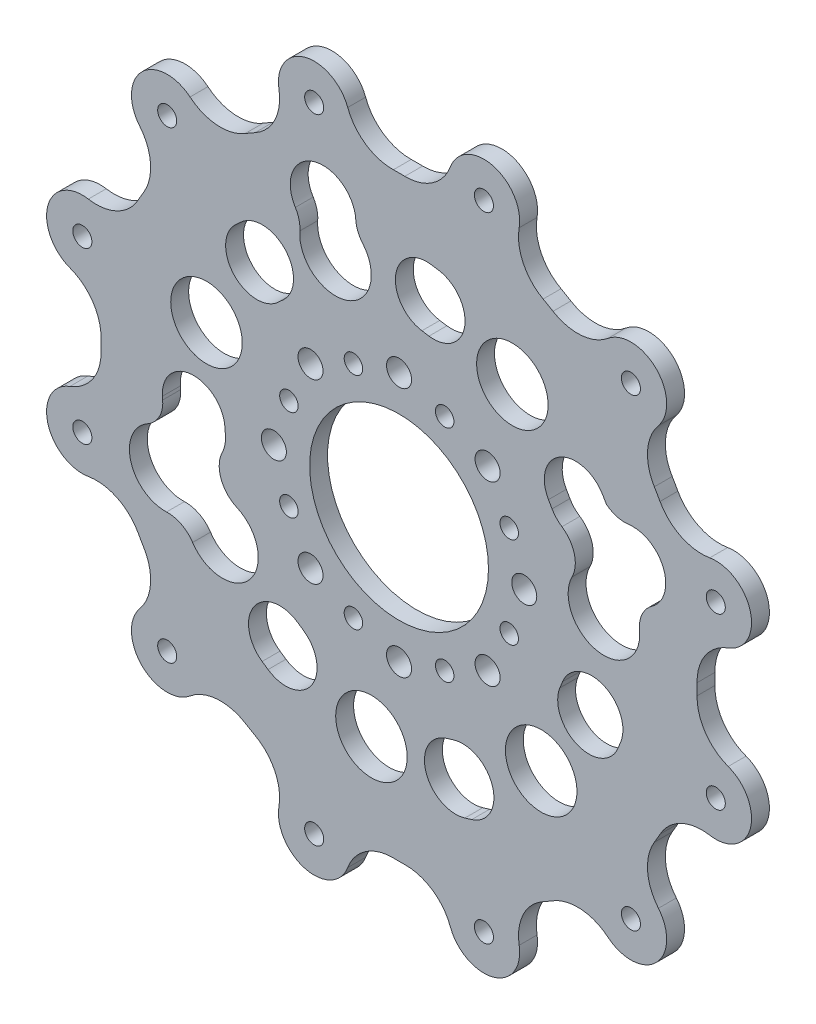
from build123d import *

# Parameters (mm, degrees)
SKETCH1_R           = 15
BOSS_EXTRUDE1_DEPTH = 3
SKETCH2_R           = 2.5
CUT_EXTRUDE1_DEPTH  = 92.972822073
SKETCH3_R           = 1.6
CUT_EXTRUDE2_DEPTH  = 92.972822073
SKETCH4_R           = 2.1
SKETCH4_R_2         = 1.55
CUT_EXTRUDE3_DEPTH  = 92.972822073
SKETCH7_R           = 6
CUT_EXTRUDE8_DEPTH  = 92.972822073
FILLET1_R           = 5
CUT_EXTRUDE9_DEPTH  = 92.972822073
SKETCH9_R           = 65
CUT_EXTRUDE10_DEPTH = 92.972822073


with BuildPart() as part:
    # Sketch1 → Boss-Extrude1 (new body)
    with BuildSketch(Plane.XY):
        with BuildLine():
            ThreePointArc((65, 0), (0, 65), (-65, 0))
            ThreePointArc((-65, 0), (-45.961940777, -45.961940777), (0, -65))
            ThreePointArc((0, -65), (45.961940777, -45.961940777), (65, 0))
        make_face()
        Circle(SKETCH1_R, mode=Mode.SUBTRACT)
    extrude(amount=BOSS_EXTRUDE1_DEPTH)

    # Sketch2 → Cut-Extrude1 (cut, through all)
    with BuildSketch(Plane.XY.offset(3)):
        with Locations((0, 61)):
            Circle(SKETCH2_R)
        with Locations((52.827549631, 30.5)):
            Circle(SKETCH2_R)
        with Locations((52.827549631, -30.5)):
            Circle(SKETCH2_R)
        with Locations((0, -61)):
            Circle(SKETCH2_R)
        with Locations((-52.827549631, -30.5)):
            Circle(SKETCH2_R)
        with Locations((-52.827549631, 30.5)):
            Circle(SKETCH2_R)
    extrude(amount=-CUT_EXTRUDE1_DEPTH, mode=Mode.SUBTRACT)

    # Sketch3 → Cut-Extrude2 (cut, through all)
    with BuildSketch(Plane.XY.offset(3)):
        with Locations((14.235047481, 53.125920446)):
            Circle(SKETCH3_R)
        with Locations((38.890872965, 38.890872965)):
            Circle(SKETCH3_R)
        with Locations((53.125920446, 14.235047481)):
            Circle(SKETCH3_R)
        with Locations((53.125920446, -14.235047481)):
            Circle(SKETCH3_R)
        with Locations((38.890872965, -38.890872965)):
            Circle(SKETCH3_R)
        with Locations((14.235047481, -53.125920446)):
            Circle(SKETCH3_R)
        with Locations((-14.235047481, -53.125920446)):
            Circle(SKETCH3_R)
        with Locations((-38.890872965, -38.890872965)):
            Circle(SKETCH3_R)
        with Locations((-53.125920446, -14.235047481)):
            Circle(SKETCH3_R)
        with Locations((-53.125920446, 14.235047481)):
            Circle(SKETCH3_R)
        with Locations((-38.890872965, 38.890872965)):
            Circle(SKETCH3_R)
        with Locations((-14.235047481, 53.125920446)):
            Circle(SKETCH3_R)
    extrude(amount=-CUT_EXTRUDE2_DEPTH, mode=Mode.SUBTRACT)

    # Sketch4 → Cut-Extrude3 (cut, through all)
    with BuildSketch(Plane.XY.offset(3)):
        with Locations((0, 21)):
            Circle(SKETCH4_R)
        with Locations((7.653668647, 18.47759065)):
            Circle(SKETCH4_R_2)
        with Locations((14.849242405, 14.849242405)):
            Circle(SKETCH4_R)
        with Locations((18.47759065, 7.653668647)):
            Circle(SKETCH4_R_2)
        with Locations((21, 0)):
            Circle(SKETCH4_R)
        with Locations((18.47759065, -7.653668647)):
            Circle(SKETCH4_R_2)
        with Locations((14.849242405, -14.849242405)):
            Circle(SKETCH4_R)
        with Locations((7.653668647, -18.47759065)):
            Circle(SKETCH4_R_2)
        with Locations((0, -21)):
            Circle(SKETCH4_R)
        with Locations((-7.653668647, -18.47759065)):
            Circle(SKETCH4_R_2)
        with Locations((-14.849242405, -14.849242405)):
            Circle(SKETCH4_R)
        with Locations((-18.47759065, -7.653668647)):
            Circle(SKETCH4_R_2)
        with Locations((-21, 0)):
            Circle(SKETCH4_R)
        with Locations((-18.47759065, 7.653668647)):
            Circle(SKETCH4_R_2)
        with Locations((-14.849242405, 14.849242405)):
            Circle(SKETCH4_R)
        with Locations((-7.653668647, 18.47759065)):
            Circle(SKETCH4_R_2)
    extrude(amount=-CUT_EXTRUDE3_DEPTH, mode=Mode.SUBTRACT)

    # Sketch7 → Cut-Extrude8 (cut, through all)
    with BuildSketch(Plane(origin=(0, 0, 0), x_dir=(-1, 0, 0), z_dir=(0, 0, -1))):
        with Locations((-19.00594586, 28.792777253)):
            Circle(SKETCH7_R)
        with Locations((-23.84166139, -24.936422802)):
            Circle(SKETCH7_R)
        with Locations((4.631047671, -34.187766781)):
            Circle(SKETCH7_R)
        with Locations((32.300103037, 12.122431431)):
            Circle(SKETCH7_R)
        with BuildLine():
            Line((29.211828059, -1.512208283), (29.124831267, -2.713277739))
            ThreePointArc((29.124831267, -2.713277739), (30.830152733, -6.977761246), (35.237764272, -8.268846605))
            ThreePointArc((35.237764272, -8.268846605), (33.723320383, -10.366915364), (33.233233248, -12.907633256))
            ThreePointArc((33.233233248, -12.907633256), (24.281529428, -20.440615416), (35.614331428, -17.534342832))
            ThreePointArc((35.614331428, -17.534342832), (45.085903335, -14.058842365), (38.003002053, -6.873977208))
            ThreePointArc((38.003002053, -6.873977208), (39.114966606, -5.320419988), (39.597395019, -3.471834575))
            Line((39.597395019, -3.471834575), (39.68439181, -2.270765119))
            ThreePointArc((39.68439181, -2.270765119), (34.827388353, 3.344795175), (29.211828059, -1.512208283))
        make_face()
        with BuildLine():
            Line((19.395568932, 21.895880394), (20.280361233, 21.079009006))
            ThreePointArc((20.280361233, 21.079009006), (27.699075186, 21.375122645), (27.402961547, 28.793836598))
            Line((27.402961547, 28.793836598), (26.518169246, 29.610707986))
            ThreePointArc((26.518169246, 29.610707986), (19.099455293, 29.314594347), (19.395568932, 21.895880394))
        make_face()
        with BuildLine():
            Line((-5.025949199, 28.81592454), (-3.835634454, 28.998372037))
            ThreePointArc((-3.835634454, 28.998372037), (0.558347074, 34.983179998), (-5.426460888, 39.377161525))
            Line((-5.426460888, 39.377161525), (-6.616775633, 39.194714029))
            ThreePointArc((-6.616775633, 39.194714029), (-11.01075716, 33.209906067), (-5.025949199, 28.81592454))
        make_face()
        with BuildLine():
            Line((-25.662825072, 14.036989769), (-25.063319164, 15.081369464))
            ThreePointArc((-25.063319164, 15.081369464), (-27.002827773, 22.248189286), (-34.169647595, 20.308680677))
            Line((-34.169647595, 20.308680677), (-34.769153502, 19.264300982))
            ThreePointArc((-34.769153502, 19.264300982), (-35.275067351, 18.053581277), (-35.464947632, 16.755222118))
            ThreePointArc((-35.464947632, 16.755222118), (-44.442683907, 14.504562533), (-38.661641025, 7.276508826))
            ThreePointArc((-38.661641025, 7.276508826), (-31.658862246, -2.264480346), (-35.170045167, 9.037775159))
            ThreePointArc((-35.170045167, 9.037775159), (-34.102679785, 10.75961664), (-33.731082846, 12.751079083))
            ThreePointArc((-33.731082846, 12.751079083), (-29.389678664, 11.466080711), (-25.662825072, 14.036989769))
        make_face()
        with BuildLine():
            Line((-26.975070239, -11.3120846), (-27.417813345, -10.192211919))
            ThreePointArc((-27.417813345, -10.192211919), (-34.230322549, -7.240141739), (-37.182392729, -14.052650943))
            Line((-37.182392729, -14.052650943), (-36.739649623, -15.172523625))
            ThreePointArc((-36.739649623, -15.172523625), (-29.927140419, -18.124593804), (-26.975070239, -11.3120846))
        make_face()
        with BuildLine():
            Line((-7.974537326, -28.142928541), (-9.126134856, -27.790849843))
            ThreePointArc((-9.126134856, -27.790849843), (-15.681686275, -31.276498362), (-12.196037756, -37.832049781))
            Line((-12.196037756, -37.832049781), (-11.044440225, -38.184128479))
            ThreePointArc((-11.044440225, -38.184128479), (-4.488888807, -34.69847996), (-7.974537326, -28.142928541))
        make_face()
        with BuildLine():
            Line((17.030984845, -23.781573279), (16.037709319, -24.462411006))
            ThreePointArc((16.037709319, -24.462411006), (14.675579613, -31.761013795), (21.974182401, -33.123143501))
            Line((21.974182401, -33.123143501), (22.967457927, -32.442305774))
            ThreePointArc((22.967457927, -32.442305774), (24.329587633, -25.143702985), (17.030984845, -23.781573279))
        make_face()
        with BuildLine():
            ThreePointArc((7.42034117, 37.860961765), (8.80698434, 27.105110714), (16.250932852, 34.991728599))
            ThreePointArc((16.250932852, 34.991728599), (14.446544487, 44.461892137), (7.42034117, 37.860961765))
        make_face()
    extrude(amount=-CUT_EXTRUDE8_DEPTH, mode=Mode.SUBTRACT)

    # Fillet1
    # the kernel refuses this fillet: 5 mm, written as the material it takes off along each edge
    with BuildSketch(Plane(origin=(38.661641025, 7.276508826, -9.896060759), x_dir=(0.42185900766131856, -0.9066614459956968, 0), z_dir=(0, 0, 1))) as fillet1_piece_1:
        with BuildLine():
            CenterArc((5.607767764, 4.720134124), FILLET1_R, 190.403540924, 60.335653251)
            ThreePointArc((0.6899662, 3.817234472), (0.692683339, 1.845770321), (0, 0))
            ThreePointArc((0, 0), (1.979212152, 0.335839051), (3.958424304, 0))
        make_face()
    extrude(amount=22.792121518, mode=Mode.SUBTRACT)
    with BuildSketch(Plane(origin=(35.464947632, 16.755222118, -8.483370588), x_dir=(-0.2672258860055957, 0.9636339169251591, 0), z_dir=(0, 0, 1))) as fillet1_piece_2:
        with BuildLine():
            CenterArc((5.523232667, -4.059153148), FILLET1_R, 125.724823578, 46.055940706)
            ThreePointArc((0.574591213, -3.344347049), (0.551663608, -1.626752541), (0, 0))
            ThreePointArc((0, 0), (1.301883848, -0.163980098), (2.603767696, 0))
        make_face()
    extrude(amount=19.966741176, mode=Mode.SUBTRACT)
    with BuildSketch(Plane(origin=(-16.250932852, 34.991728599, -4.440296256), x_dir=(-0.660275414523551, 0.7510235528768409, 0), z_dir=(0, 0, 1))) as fillet1_piece_3:
        with BuildLine():
            CenterArc((2.531667396, 4.937012043), FILLET1_R, 224.394439463, 36.501432246)
            ThreePointArc((-1.041035496, 1.439042053), (-0.466974775, 0.758255222), (0, 0))
            ThreePointArc((0, 0), (0.870260667, 0.069286753), (1.740521335, 0))
        make_face()
    extrude(amount=11.880592512, mode=Mode.SUBTRACT)
    with BuildSketch(Plane(origin=(-7.42034117, 37.860961765, -4.440296256), x_dir=(0.09273346281218257, 0.9956909685614617, 0), z_dir=(0, 0, 1))) as fillet1_piece_4:
        with BuildLine():
            CenterArc((2.531667396, -4.937012043), FILLET1_R, 99.104128291, 36.501432246)
            ThreePointArc((-1.041035496, -1.439042053), (-0.466974775, -0.758255222), (0, 0))
            ThreePointArc((0, 0), (0.870260667, -0.069286753), (1.740521335, 0))
        make_face()
    extrude(amount=11.880592512, mode=Mode.SUBTRACT)
    with BuildSketch(Plane(origin=(-35.614331428, -17.534342832, -8.986889126), x_dir=(-0.941830418205035, -0.33608847546997045, 0), z_dir=(0, 0, 1))) as fillet1_piece_5:
        with BuildLine():
            CenterArc((5.092570505, 4.770382654), FILLET1_R, 193.689385096, 58.879258864)
            ThreePointArc((0.234605599, 3.587091914), (0.392256184, 1.775563255), (0, 0))
            ThreePointArc((0, 0), (1.797377825, 0.275540816), (3.59475565, 0))
        make_face()
    extrude(amount=20.973778252, mode=Mode.SUBTRACT)
    with BuildSketch(Plane(origin=(-38.003002053, -6.873977208, -10.974059848), x_dir=(-0.3742490954926046, 0.9273282129445687, 0), z_dir=(0, 0, 1))) as fillet1_piece_6:
        with BuildLine():
            CenterArc((5.92101268, 4.759710971), FILLET1_R, 187.432417981, 64.732529201)
            Line((0.963022025, 4.112927651), (0.467222959, 4.048249319))
            ThreePointArc((0.467222959, 4.048249319), (0.368596297, 2.082902257), (-0.41554723, 0.278065639))
            Line((-0.41554723, 0.278065639), (0.204156647, -0.456420928))
            ThreePointArc((0.204156647, -0.456420928), (3.598464099, -0.270694321), (4.236485065, -0.475971097))
            Line((4.236485065, -0.475971097), (4.389623939, 0))
        make_face()
    extrude(amount=24.948119696, mode=Mode.SUBTRACT)

    # Sketch8 → Cut-Extrude9 (cut, through all)
    with BuildSketch(Plane.XY.offset(3)):
        with BuildLine():
            ThreePointArc((-29.65430959, -5.418174422), (-29.87199695, -9.337936117), (-27.192023103, -12.206674465))
            ThreePointArc((-27.192023103, -12.206674465), (-30.308021104, -11.735010341), (-33.233233248, -12.907633256))
            ThreePointArc((-33.233233248, -12.907633256), (-33.723320383, -10.366915364), (-35.237764272, -8.268846605))
            ThreePointArc((-35.237764272, -8.268846605), (-31.973834384, -7.768387648), (-29.65430959, -5.418174422))
        make_face()
        with BuildLine():
            ThreePointArc((35.170045167, 9.037775159), (31.582172041, 8.410214133), (29.018390153, 5.822997706))
            ThreePointArc((29.018390153, 5.822997706), (29.401567289, 9.370552414), (27.322154308, 12.270209425))
            ThreePointArc((27.322154308, 12.270209425), (30.60879899, 11.415361187), (33.731082846, 12.751079083))
            ThreePointArc((33.731082846, 12.751079083), (34.102679785, 10.75961664), (35.170045167, 9.037775159))
        make_face()
    extrude(amount=-CUT_EXTRUDE9_DEPTH, mode=Mode.SUBTRACT)

    # Sketch9 → Cut-Extrude10 (cut, through all)
    with BuildSketch(Plane.XY.offset(3)):
        Circle(SKETCH9_R)
        with BuildLine():
            ThreePointArc((-20.149761589, 52.117874306), (-15.787961751, 58.921475404), (-8.608731737, 55.210283935))
            ThreePointArc((-8.608731737, 55.210283935), (-5.613939934, 51.379799195), (-0.954290873, 49.99089246))
            ThreePointArc((-0.954290873, 49.99089246), (0, 50), (0.954290873, 49.99089246))
            ThreePointArc((0.954290873, 49.99089246), (5.613939934, 51.379799195), (8.608731737, 55.210283935))
            ThreePointArc((8.608731737, 55.210283935), (15.293845275, 59.031760541), (20.235047481, 53.125920446))
            ThreePointArc((20.235047481, 53.125920446), (20.213687989, 52.620096686), (20.149761589, 52.117874306))
            ThreePointArc((20.149761589, 52.117874306), (20.828084999, 47.303181311), (24.169006092, 43.770528264))
            ThreePointArc((24.169006092, 43.770528264), (25, 43.301270189), (25.821886368, 42.816237392))
            ThreePointArc((25.821886368, 42.816237392), (30.551714195, 41.689241377), (35.060522346, 43.509142569))
            ThreePointArc((35.060522346, 43.509142569), (41.442136994, 44.321439405), (44.890872965, 38.890872965))
            ThreePointArc((44.890872965, 38.890872965), (44.534879416, 36.854898705), (43.509142569, 35.060522346))
            ThreePointArc((43.509142569, 35.060522346), (41.689241377, 30.551714195), (42.816237392, 25.821886368))
            ThreePointArc((42.816237392, 25.821886368), (43.301270189, 25), (43.770528264, 24.169006092))
            ThreePointArc((43.770528264, 24.169006092), (47.303181311, 20.828084999), (52.117874306, 20.149761589))
            ThreePointArc((52.117874306, 20.149761589), (56.995786281, 18.820256137), (59.125920446, 14.235047481))
            ThreePointArc((59.125920446, 14.235047481), (58.050663126, 10.807671001), (55.210283935, 8.608731737))
            ThreePointArc((55.210283935, 8.608731737), (51.379799195, 5.613939934), (49.99089246, 0.954290873))
            ThreePointArc((49.99089246, 0.954290873), (49.997723063, 0.477167166), (50, 0))
            ThreePointArc((50, 0), (49.997723063, -0.477167166), (49.99089246, -0.954290873))
            ThreePointArc((49.99089246, -0.954290873), (51.379799195, -5.613939934), (55.210283935, -8.608731737))
            ThreePointArc((55.210283935, -8.608731737), (58.050663126, -10.807671001), (59.125920446, -14.235047481))
            ThreePointArc((59.125920446, -14.235047481), (56.995786281, -18.820256137), (52.117874306, -20.149761589))
            ThreePointArc((52.117874306, -20.149761589), (47.303181311, -20.828084999), (43.770528264, -24.169006092))
            ThreePointArc((43.770528264, -24.169006092), (43.301270189, -25), (42.816237392, -25.821886368))
            ThreePointArc((42.816237392, -25.821886368), (41.689241377, -30.551714195), (43.509142569, -35.060522346))
            ThreePointArc((43.509142569, -35.060522346), (44.534879416, -36.854898705), (44.890872965, -38.890872965))
            ThreePointArc((44.890872965, -38.890872965), (41.442136994, -44.321439405), (35.060522346, -43.509142569))
            ThreePointArc((35.060522346, -43.509142569), (30.551714195, -41.689241377), (25.821886368, -42.816237392))
            ThreePointArc((25.821886368, -42.816237392), (25, -43.301270189), (24.169006092, -43.770528264))
            ThreePointArc((24.169006092, -43.770528264), (20.828084999, -47.303181311), (20.149761589, -52.117874306))
            ThreePointArc((20.149761589, -52.117874306), (20.213687989, -52.620096686), (20.235047481, -53.125920446))
            ThreePointArc((20.235047481, -53.125920446), (15.293845275, -59.031760541), (8.608731737, -55.210283935))
            ThreePointArc((8.608731737, -55.210283935), (5.613939934, -51.379799195), (0.954290873, -49.99089246))
            ThreePointArc((0.954290873, -49.99089246), (0, -50), (-0.954290873, -49.99089246))
            ThreePointArc((-0.954290873, -49.99089246), (-5.613939934, -51.379799195), (-8.608731737, -55.210283935))
            ThreePointArc((-8.608731737, -55.210283935), (-15.787961751, -58.921475404), (-20.149761589, -52.117874306))
            ThreePointArc((-20.149761589, -52.117874306), (-20.828084999, -47.303181311), (-24.169006092, -43.770528264))
            ThreePointArc((-24.169006092, -43.770528264), (-25, -43.301270189), (-25.821886368, -42.816237392))
            ThreePointArc((-25.821886368, -42.816237392), (-30.551714195, -41.689241377), (-35.060522346, -43.509142569))
            ThreePointArc((-35.060522346, -43.509142569), (-43.133513652, -43.133513652), (-43.509142569, -35.060522346))
            ThreePointArc((-43.509142569, -35.060522346), (-41.689241377, -30.551714195), (-42.816237392, -25.821886368))
            ThreePointArc((-42.816237392, -25.821886368), (-43.301270189, -25), (-43.770528264, -24.169006092))
            ThreePointArc((-43.770528264, -24.169006092), (-47.303181311, -20.828084999), (-52.117874306, -20.149761589))
            ThreePointArc((-52.117874306, -20.149761589), (-58.921475404, -15.787961751), (-55.210283935, -8.608731737))
            ThreePointArc((-55.210283935, -8.608731737), (-51.379799195, -5.613939934), (-49.99089246, -0.954290873))
            ThreePointArc((-49.99089246, -0.954290873), (-50, 0), (-49.99089246, 0.954290873))
            ThreePointArc((-49.99089246, 0.954290873), (-51.379799195, 5.613939934), (-55.210283935, 8.608731737))
            ThreePointArc((-55.210283935, 8.608731737), (-58.921475404, 15.787961751), (-52.117874306, 20.149761589))
            ThreePointArc((-52.117874306, 20.149761589), (-47.303181311, 20.828084999), (-43.770528264, 24.169006092))
            ThreePointArc((-43.770528264, 24.169006092), (-43.301270189, 25), (-42.816237392, 25.821886368))
            ThreePointArc((-42.816237392, 25.821886368), (-41.689241377, 30.551714195), (-43.509142569, 35.060522346))
            ThreePointArc((-43.509142569, 35.060522346), (-43.133513652, 43.133513652), (-35.060522346, 43.509142569))
            ThreePointArc((-35.060522346, 43.509142569), (-30.551714195, 41.689241377), (-25.821886368, 42.816237392))
            ThreePointArc((-25.821886368, 42.816237392), (-25, 43.301270189), (-24.169006092, 43.770528264))
            ThreePointArc((-24.169006092, 43.770528264), (-20.828084999, 47.303181311), (-20.149761589, 52.117874306))
        make_face(mode=Mode.SUBTRACT)
    extrude(amount=-CUT_EXTRUDE10_DEPTH, mode=Mode.SUBTRACT)


solid = part.part
